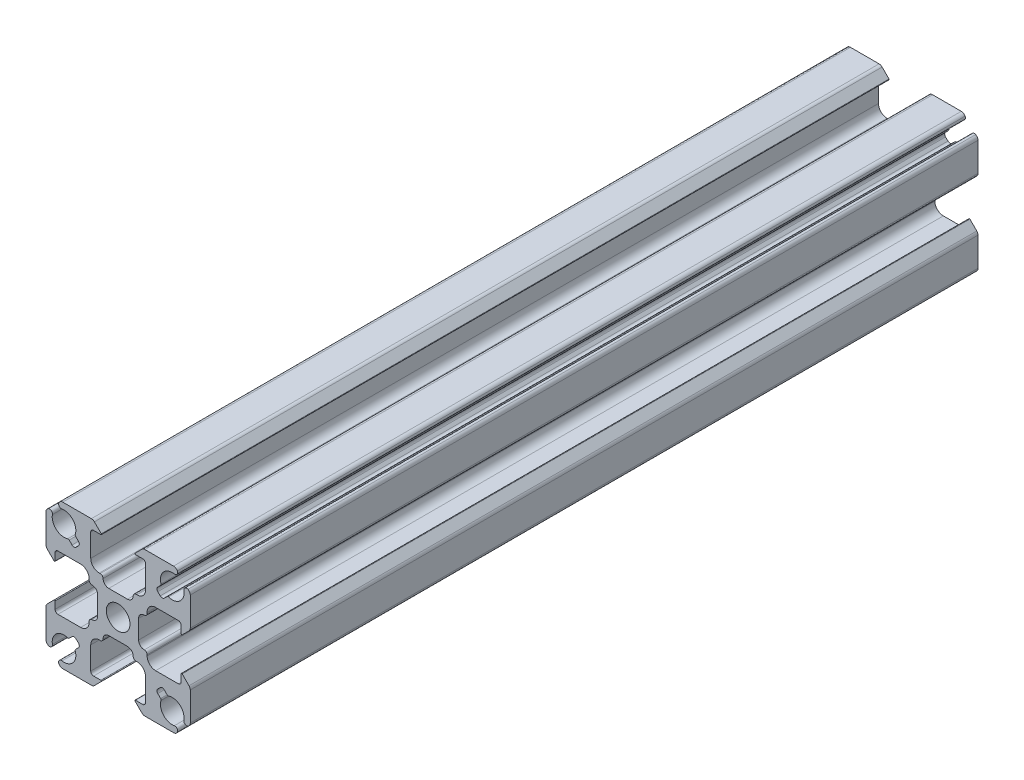
from build123d import *

# Parameters (mm, degrees)
SKETCH1_R           = 2.08
BOSS_EXTRUDE1_DEPTH = 69.341494032
SKETCH2_R           = 3.025000046
CUT_EXTRUDE1_DEPTH  = 73.354839469


with BuildPart() as part:
    # Sketch1 → Boss-Extrude1 (new, symmetric)
    with BuildSketch(Plane(origin=(0, 0, 0), x_dir=(-1, 0, 0), z_dir=(0, 0, -1))):
        with BuildLine():
            Line((-7.48853247, 8.61990332), (-6.985643798, 8.117014648))
            ThreePointArc((-6.985643798, 8.117014648), (-6.839197188, 7.763461257), (-6.985643798, 7.409907866))
            Line((-6.985643798, 7.409907866), (-7.409907866, 6.985643798))
            ThreePointArc((-7.409907866, 6.985643798), (-7.763461257, 6.839197188), (-8.117014648, 6.985643798))
            Line((-8.117014648, 6.985643798), (-8.61990332, 7.48853247))
            ThreePointArc((-8.61990332, 7.48853247), (-8.738774884, 7.554957329), (-8.874825936, 7.549228331))
            ThreePointArc((-8.874825936, 7.549228331), (-10.889377278, 7.955008076), (-11.572136222, 9.893284252))
            ThreePointArc((-11.572136222, 9.893284252), (-11.766795458, 10.383720777), (-12.292708824, 10.42656157))
            ThreePointArc((-12.292708824, 10.42656157), (-12.590129525, 10.150252615), (-12.7, 9.759440396))
            Line((-12.7, 9.759440396), (-12.7, 4.710660172))
            ThreePointArc((-12.7, 4.710660172), (-12.642909649, 4.423647598), (-12.480330086, 4.180330086))
            Line((-12.480330086, 4.180330086), (-11.270710678, 2.970710678))
            ThreePointArc((-11.270710678, 2.970710678), (-11.161731657, 2.949033403), (-11.1, 3.041421356))
            Line((-11.1, 3.041421356), (-11.1, 4.325))
            ThreePointArc((-11.1, 4.325), (-10.953553391, 4.678553391), (-10.6, 4.825))
            Line((-10.6, 4.825), (-6.6, 4.825))
            ThreePointArc((-6.6, 4.825), (-5.539339828, 4.385660172), (-5.1, 3.325))
            Line((-5.1, 3.325), (-5.1, 3.15))
            ThreePointArc((-5.1, 3.15), (-4.953553391, 2.796446609), (-4.6, 2.65))
            ThreePointArc((-4.6, 2.65), (-3.892893219, 2.357106781), (-3.6, 1.65))
            Line((-3.6, 1.65), (-3.6, -1.65))
            ThreePointArc((-3.6, -1.65), (-3.892893219, -2.357106781), (-4.6, -2.65))
            ThreePointArc((-4.6, -2.65), (-4.953553391, -2.796446609), (-5.1, -3.15))
            Line((-5.1, -3.15), (-5.1, -3.325))
            ThreePointArc((-5.1, -3.325), (-5.539339828, -4.385660172), (-6.6, -4.825))
            Line((-6.6, -4.825), (-10.6, -4.825))
            ThreePointArc((-10.6, -4.825), (-10.953553391, -4.678553391), (-11.1, -4.325))
            Line((-11.1, -4.325), (-11.1, -3.041421356))
            ThreePointArc((-11.1, -3.041421356), (-11.161731657, -2.949033403), (-11.270710678, -2.970710678))
            Line((-11.270710678, -2.970710678), (-12.480330086, -4.180330086))
            ThreePointArc((-12.480330086, -4.180330086), (-12.642909649, -4.423647598), (-12.7, -4.710660172))
            Line((-12.7, -4.710660172), (-12.7, -9.759440396))
            ThreePointArc((-12.7, -9.759440396), (-12.590129525, -10.150252615), (-12.292708824, -10.42656157))
            ThreePointArc((-12.292708824, -10.42656157), (-11.766795458, -10.383720777), (-11.572136222, -9.893284252))
            ThreePointArc((-11.572136222, -9.893284252), (-10.889377278, -7.955008076), (-8.874825936, -7.549228331))
            ThreePointArc((-8.874825936, -7.549228331), (-8.738774884, -7.554957329), (-8.61990332, -7.48853247))
            Line((-8.61990332, -7.48853247), (-8.117014648, -6.985643798))
            ThreePointArc((-8.117014648, -6.985643798), (-7.763461257, -6.839197188), (-7.409907866, -6.985643798))
            Line((-7.409907866, -6.985643798), (-6.985643798, -7.409907866))
            ThreePointArc((-6.985643798, -7.409907866), (-6.839197188, -7.763461257), (-6.985643798, -8.117014648))
            Line((-6.985643798, -8.117014648), (-7.48853247, -8.61990332))
            ThreePointArc((-7.48853247, -8.61990332), (-7.554957329, -8.738774884), (-7.549228331, -8.874825936))
            ThreePointArc((-7.549228331, -8.874825936), (-7.955008076, -10.889377278), (-9.893284252, -11.572136222))
            ThreePointArc((-9.893284252, -11.572136222), (-10.383720777, -11.766795458), (-10.42656157, -12.292708824))
            ThreePointArc((-10.42656157, -12.292708824), (-10.150252615, -12.590129525), (-9.759440396, -12.7))
            Line((-9.759440396, -12.7), (-4.710660172, -12.7))
            ThreePointArc((-4.710660172, -12.7), (-4.423647598, -12.642909649), (-4.180330086, -12.480330086))
            Line((-4.180330086, -12.480330086), (-2.970710678, -11.270710678))
            ThreePointArc((-2.970710678, -11.270710678), (-2.949033403, -11.161731657), (-3.041421356, -11.1))
            Line((-3.041421356, -11.1), (-4.325, -11.1))
            ThreePointArc((-4.325, -11.1), (-4.678553391, -10.953553391), (-4.825, -10.6))
            Line((-4.825, -10.6), (-4.825, -6.6))
            ThreePointArc((-4.825, -6.6), (-4.385660172, -5.539339828), (-3.325, -5.1))
            Line((-3.325, -5.1), (-3.15, -5.1))
            ThreePointArc((-3.15, -5.1), (-2.796446609, -4.953553391), (-2.65, -4.6))
            ThreePointArc((-2.65, -4.6), (-2.357106781, -3.892893219), (-1.65, -3.6))
            Line((-1.65, -3.6), (1.65, -3.6))
            ThreePointArc((1.65, -3.6), (2.357106781, -3.892893219), (2.65, -4.6))
            ThreePointArc((2.65, -4.6), (2.796446609, -4.953553391), (3.15, -5.1))
            Line((3.15, -5.1), (3.325, -5.1))
            ThreePointArc((3.325, -5.1), (4.385660172, -5.539339828), (4.825, -6.6))
            Line((4.825, -6.6), (4.825, -10.6))
            ThreePointArc((4.825, -10.6), (4.678553391, -10.953553391), (4.325, -11.1))
            Line((4.325, -11.1), (3.041421356, -11.1))
            ThreePointArc((3.041421356, -11.1), (2.949033403, -11.161731657), (2.970710678, -11.270710678))
            Line((2.970710678, -11.270710678), (4.180330086, -12.480330086))
            ThreePointArc((4.180330086, -12.480330086), (4.423647598, -12.642909649), (4.710660172, -12.7))
            Line((4.710660172, -12.7), (9.759440396, -12.7))
            ThreePointArc((9.759440396, -12.7), (10.150252615, -12.590129525), (10.42656157, -12.292708824))
            ThreePointArc((10.42656157, -12.292708824), (10.383720777, -11.766795458), (9.893284252, -11.572136222))
            ThreePointArc((9.893284252, -11.572136222), (7.955008076, -10.889377278), (7.549228331, -8.874825936))
            ThreePointArc((7.549228331, -8.874825936), (7.554957329, -8.738774884), (7.48853247, -8.61990332))
            Line((7.48853247, -8.61990332), (6.985643798, -8.117014648))
            ThreePointArc((6.985643798, -8.117014648), (6.839197188, -7.763461257), (6.985643798, -7.409907866))
            Line((6.985643798, -7.409907866), (7.409907866, -6.985643798))
            ThreePointArc((7.409907866, -6.985643798), (7.763461257, -6.839197188), (8.117014648, -6.985643798))
            Line((8.117014648, -6.985643798), (8.61990332, -7.48853247))
            ThreePointArc((8.61990332, -7.48853247), (8.738774884, -7.554957329), (8.874825936, -7.549228331))
            ThreePointArc((8.874825936, -7.549228331), (10.889377278, -7.955008076), (11.572136222, -9.893284252))
            ThreePointArc((11.572136222, -9.893284252), (11.766795458, -10.383720777), (12.292708824, -10.42656157))
            ThreePointArc((12.292708824, -10.42656157), (12.590129525, -10.150252615), (12.7, -9.759440396))
            Line((12.7, -9.759440396), (12.7, -4.710660172))
            ThreePointArc((12.7, -4.710660172), (12.642909649, -4.423647598), (12.480330086, -4.180330086))
            Line((12.480330086, -4.180330086), (11.270710678, -2.970710678))
            ThreePointArc((11.270710678, -2.970710678), (11.161731657, -2.949033403), (11.1, -3.041421356))
            Line((11.1, -3.041421356), (11.1, -4.325))
            ThreePointArc((11.1, -4.325), (10.953553391, -4.678553391), (10.6, -4.825))
            Line((10.6, -4.825), (6.6, -4.825))
            ThreePointArc((6.6, -4.825), (5.539339828, -4.385660172), (5.1, -3.325))
            Line((5.1, -3.325), (5.1, -3.15))
            ThreePointArc((5.1, -3.15), (4.953553391, -2.796446609), (4.6, -2.65))
            ThreePointArc((4.6, -2.65), (3.892893219, -2.357106781), (3.6, -1.65))
            Line((3.6, -1.65), (3.6, 1.65))
            ThreePointArc((3.6, 1.65), (3.892893219, 2.357106781), (4.6, 2.65))
            ThreePointArc((4.6, 2.65), (4.953553391, 2.796446609), (5.1, 3.15))
            Line((5.1, 3.15), (5.1, 3.325))
            ThreePointArc((5.1, 3.325), (5.539339828, 4.385660172), (6.6, 4.825))
            Line((6.6, 4.825), (10.6, 4.825))
            ThreePointArc((10.6, 4.825), (10.953553391, 4.678553391), (11.1, 4.325))
            Line((11.1, 4.325), (11.1, 3.041421356))
            ThreePointArc((11.1, 3.041421356), (11.161731657, 2.949033403), (11.270710678, 2.970710678))
            Line((11.270710678, 2.970710678), (12.480330086, 4.180330086))
            ThreePointArc((12.480330086, 4.180330086), (12.642909649, 4.423647598), (12.7, 4.710660172))
            Line((12.7, 4.710660172), (12.7, 9.759440396))
            ThreePointArc((12.7, 9.759440396), (12.590129525, 10.150252615), (12.292708824, 10.42656157))
            ThreePointArc((12.292708824, 10.42656157), (11.766795458, 10.383720777), (11.572136222, 9.893284252))
            ThreePointArc((11.572136222, 9.893284252), (10.889377278, 7.955008076), (8.874825936, 7.549228331))
            ThreePointArc((8.874825936, 7.549228331), (8.738774884, 7.554957329), (8.61990332, 7.48853247))
            Line((8.61990332, 7.48853247), (8.117014648, 6.985643798))
            ThreePointArc((8.117014648, 6.985643798), (7.763461257, 6.839197188), (7.409907866, 6.985643798))
            Line((7.409907866, 6.985643798), (6.985643798, 7.409907866))
            ThreePointArc((6.985643798, 7.409907866), (6.839197188, 7.763461257), (6.985643798, 8.117014648))
            Line((6.985643798, 8.117014648), (7.48853247, 8.61990332))
            ThreePointArc((7.48853247, 8.61990332), (7.554957329, 8.738774884), (7.549228331, 8.874825936))
            ThreePointArc((7.549228331, 8.874825936), (7.955008076, 10.889377278), (9.893284252, 11.572136222))
            ThreePointArc((9.893284252, 11.572136222), (10.383720777, 11.766795458), (10.42656157, 12.292708824))
            ThreePointArc((10.42656157, 12.292708824), (10.150252615, 12.590129525), (9.759440396, 12.7))
            Line((9.759440396, 12.7), (4.710660172, 12.7))
            ThreePointArc((4.710660172, 12.7), (4.423647598, 12.642909649), (4.180330086, 12.480330086))
            Line((4.180330086, 12.480330086), (2.970710678, 11.270710678))
            ThreePointArc((2.970710678, 11.270710678), (2.949033403, 11.161731657), (3.041421356, 11.1))
            Line((3.041421356, 11.1), (4.325, 11.1))
            ThreePointArc((4.325, 11.1), (4.678553391, 10.953553391), (4.825, 10.6))
            Line((4.825, 10.6), (4.825, 6.6))
            ThreePointArc((4.825, 6.6), (4.385660172, 5.539339828), (3.325, 5.1))
            Line((3.325, 5.1), (3.15, 5.1))
            ThreePointArc((3.15, 5.1), (2.796446609, 4.953553391), (2.65, 4.6))
            ThreePointArc((2.65, 4.6), (2.357106781, 3.892893219), (1.65, 3.6))
            Line((1.65, 3.6), (-1.65, 3.6))
            ThreePointArc((-1.65, 3.6), (-2.357106781, 3.892893219), (-2.65, 4.6))
            ThreePointArc((-2.65, 4.6), (-2.796446609, 4.953553391), (-3.15, 5.1))
            Line((-3.15, 5.1), (-3.325, 5.1))
            ThreePointArc((-3.325, 5.1), (-4.385660172, 5.539339828), (-4.825, 6.6))
            Line((-4.825, 6.6), (-4.825, 10.6))
            ThreePointArc((-4.825, 10.6), (-4.678553391, 10.953553391), (-4.325, 11.1))
            Line((-4.325, 11.1), (-3.041421356, 11.1))
            ThreePointArc((-3.041421356, 11.1), (-2.949033403, 11.161731657), (-2.970710678, 11.270710678))
            Line((-2.970710678, 11.270710678), (-4.180330086, 12.480330086))
            ThreePointArc((-4.180330086, 12.480330086), (-4.423647598, 12.642909649), (-4.710660172, 12.7))
            Line((-4.710660172, 12.7), (-9.759440396, 12.7))
            ThreePointArc((-9.759440396, 12.7), (-10.150252615, 12.590129525), (-10.42656157, 12.292708824))
            ThreePointArc((-10.42656157, 12.292708824), (-10.383720777, 11.766795458), (-9.893284252, 11.572136222))
            ThreePointArc((-9.893284252, 11.572136222), (-7.955008076, 10.889377278), (-7.549228331, 8.874825936))
            ThreePointArc((-7.549228331, 8.874825936), (-7.554957329, 8.738774884), (-7.48853247, 8.61990332))
        make_face()
        Circle(SKETCH1_R, mode=Mode.SUBTRACT)
    extrude(amount=BOSS_EXTRUDE1_DEPTH, both=True)

    # Sketch2 → Cut-Extrude1 (cut, through all)
    with BuildSketch(Plane(origin=(3.6, 0, 0), x_dir=(0, 0, -1), z_dir=(1, 0, 0))):
        with Locations((56.641494032, 0)):
            Circle(SKETCH2_R)
        with Locations((5.841494032, 0)):
            Circle(SKETCH2_R)
    extrude(amount=-CUT_EXTRUDE1_DEPTH, mode=Mode.SUBTRACT)


solid = part.part
